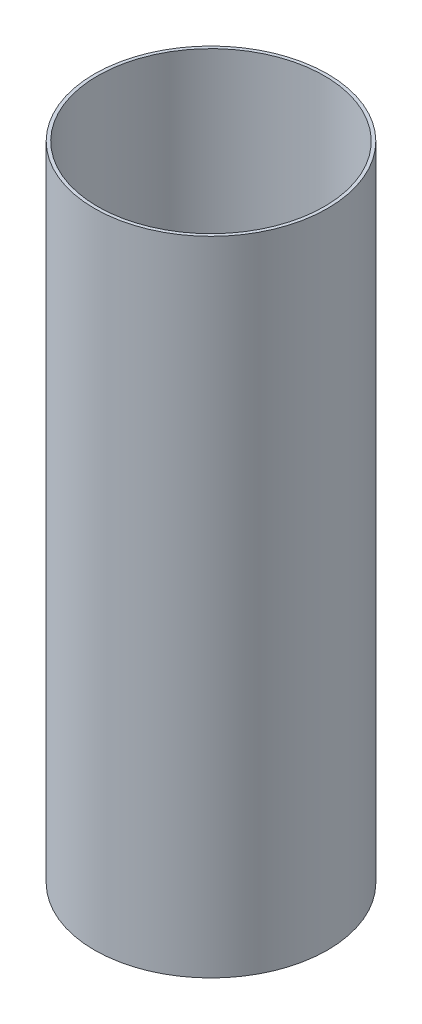
from build123d import *

# Parameters (mm, degrees)
SKETCH1_R           = 78.359
SKETCH1_R_2         = 76.2
BOSS_EXTRUDE1_DEPTH = 431.8


with BuildPart() as part:
    # Sketch1 → Boss-Extrude1 (new body)
    with BuildSketch(Plane(origin=(0, 0, 0), x_dir=(1, 0, 0), z_dir=(0, 1, 0))):
        Circle(SKETCH1_R)
        Circle(SKETCH1_R_2, mode=Mode.SUBTRACT)
    extrude(amount=BOSS_EXTRUDE1_DEPTH)


solid = part.part
